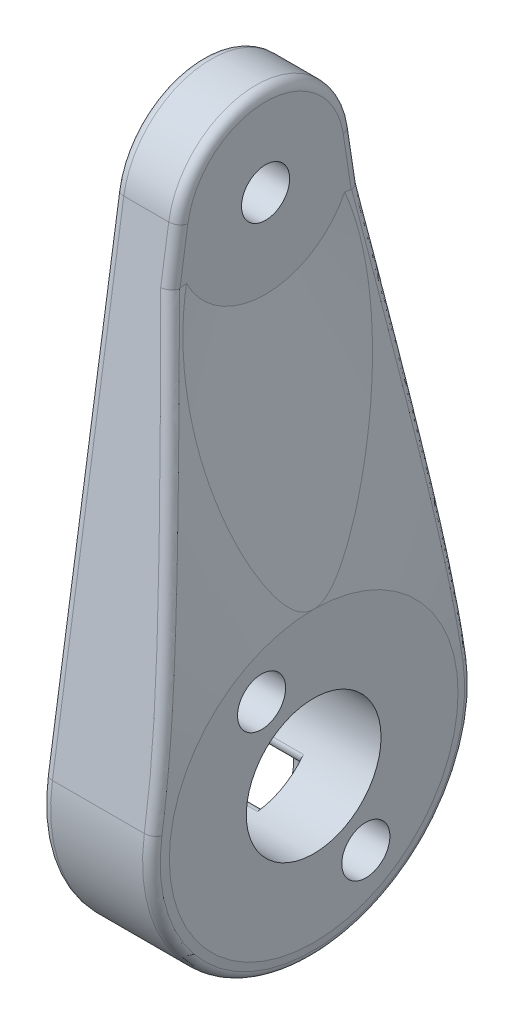
from build123d import *

# Parameters (mm, degrees)
ESQUISSE1_R             = 1.5
ESQUISSE1_R_2           = 4.2
BOSS_EXTRU_1_DEPTH      = 7
ESQUISSE2_R             = 1.5
ENL_V_MAT_EXTRU_1_DEPTH = 38.539978689
ESQUISSE3_R             = 2.5
ENL_V_MAT_EXTRU_2_DEPTH = 3
CONG_1_R                = 0.4
CONG_2_R                = 0.6


with BuildPart() as part:
    # Esquisse1 → Boss.-Extru.1 (new body)
    with BuildSketch(Plane(origin=(0, 0, 0), x_dir=(0, 0, -1), z_dir=(1, 0, 0))):
        with BuildLine():
            Line((-5.437772982, 30.825), (-9.886859967, 1.5))
            ThreePointArc((-9.886859967, 1.5), (0, -10), (9.886859967, 1.5))
            Line((9.886859967, 1.5), (5.437772982, 30.825))
            ThreePointArc((5.437772982, 30.825), (0, 35.5), (-5.437772982, 30.825))
        make_face()
        with Locations((0, 30)):
            Circle(ESQUISSE1_R, mode=Mode.SUBTRACT)
        Circle(ESQUISSE1_R_2, mode=Mode.SUBTRACT)
    extrude(amount=BOSS_EXTRU_1_DEPTH)

    # Esquisse2 → Enlèv. mat.-Extru.1 (cut, through all)
    with BuildSketch(Plane(origin=(7, 0, 0), x_dir=(0, 0, -1), z_dir=(1, 0, 0))):
        with Locations((-3.25, 5.629165125)):
            Circle(ESQUISSE2_R)
        with Locations((3.25, -5.629165125)):
            Circle(ESQUISSE2_R)
    extrude(amount=-ENL_V_MAT_EXTRU_1_DEPTH, mode=Mode.SUBTRACT)

    # Esquisse3 → Enlèv. mat.-Extru.2 (cut)
    with BuildSketch(Plane.ZY):
        with Locations((3.25, 5.629165125)):
            Circle(ESQUISSE3_R)
        with Locations((-3.25, -5.629165125)):
            Circle(ESQUISSE3_R)
    extrude(amount=-ENL_V_MAT_EXTRU_2_DEPTH, mode=Mode.SUBTRACT)

    # Congé1
    cong_1_edges = [part.edges().sort_by_distance(p)[0] for p in [
        (1.5, -3.965417323, -1.384003416),
        (1.5, -3.181290778, -2.74215043),
        (1.5, 3.181290778, 2.74215043),
        (1.5, 3.965417323, 1.384003416),
    ]]
    fillet(cong_1_edges, radius=CONG_1_R)

    # Esquisse5 → Enlèvement de matière-Révolution1 (revolve, cut)
    with BuildSketch(Plane.XY):
        Polygon((7, 30), (4, 30), (4, 24.5), (7, 9), align=None)
    revolve(axis=Axis((7, 30, 0), (-1, 0, 0)), mode=Mode.SUBTRACT)

    # Esquisse6 → Enlèvement de matière-Révolution2 (revolve, cut)
    with BuildSketch(Plane.XY):
        Polygon((7, 9), (4, 28), (4, 109), (7, 109), align=None)
    revolve(axis=Axis((7, 0, 0), (-1, 0, 0)), mode=Mode.SUBTRACT)

    # Congé2
    cong_2_edges = [part.edges().sort_by_distance(p)[0] for p in [
        (4, 29.091247039, -5.70081195),
        (4, 35.5, 0),
        (5.816915836, 14.467047149, -7.919544683),
        (6.842105263, -10, 0),
        (0, 35.5, 0),
        (0, 16.1625, -7.662316474),
        (0, -10, 0),
        (4, 29.091247039, 5.70081195),
        (5.816915836, 14.467047149, 7.919544683),
        (0, 16.1625, 7.662316474),
    ]]
    fillet(cong_2_edges, radius=CONG_2_R)


solid = part.part
